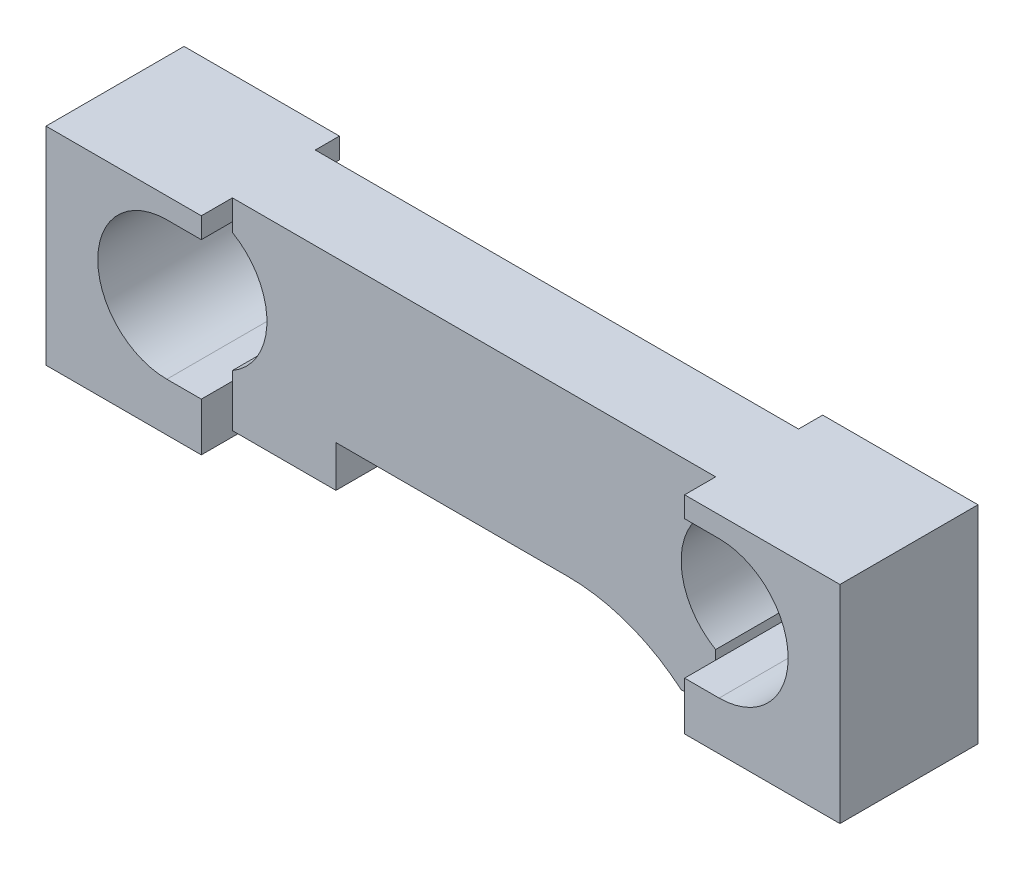
from build123d import *

# Parameters (mm, degrees)
SKETCH1_W           = 292.1
SKETCH1_H           = 50.8
BOSS_EXTRUDE1_DEPTH = 76.2
SKETCH2_W           = 177.8
SKETCH2_H           = 11.43
SKETCH2_H_2         = 8.89
CUT_EXTRUDE1_DEPTH  = 307.120058147
SKETCH3_W           = 177.8
SKETCH3_H           = 30.48
CUT_EXTRUDE2_DEPTH  = 2.032
SKETCH4_W           = 139.7
SKETCH4_H           = 30.48
CUT_EXTRUDE3_DEPTH  = 15.24
SKETCH5_W           = 12.7
SKETCH5_H           = 30.48
BOSS_EXTRUDE2_DEPTH = 15.24
FILLET1_R           = 64.77
CUT_EXTRUDE4_DEPTH  = 307.120058147
CUT_EXTRUDE5_DEPTH  = 307.120058147


with BuildPart() as part:
    # Sketch1 → Boss-Extrude1 (new body)
    with BuildSketch(Plane(origin=(0, 0, 0), x_dir=(1, 0, 0), z_dir=(0, 1, 0))):
        with Locations((146.05, 25.4)):
            Rectangle(SKETCH1_W, SKETCH1_H)
    extrude(amount=BOSS_EXTRUDE1_DEPTH)

    # Sketch2 → Cut-Extrude1 (cut, through all)
    with BuildSketch(Plane.XZ):
        with Locations((146.05, -5.715)):
            Rectangle(SKETCH2_W, SKETCH2_H)
        with Locations((146.05, -46.355)):
            Rectangle(SKETCH2_W, SKETCH2_H_2)
    extrude(amount=-CUT_EXTRUDE1_DEPTH, mode=Mode.SUBTRACT)

    # Sketch3 → Cut-Extrude2 (cut)
    with BuildSketch(Plane.XZ):
        with Locations((146.05, -26.67)):
            Rectangle(SKETCH3_W, SKETCH3_H)
    extrude(amount=-CUT_EXTRUDE2_DEPTH, mode=Mode.SUBTRACT)

    # Sketch4 → Cut-Extrude3 (cut)
    with BuildSketch(Plane.XZ.offset(-2.032)):
        with Locations((165.1, -26.67)):
            Rectangle(SKETCH4_W, SKETCH4_H)
    extrude(amount=-CUT_EXTRUDE3_DEPTH, mode=Mode.SUBTRACT)

    # Sketch5 → Boss-Extrude2 (add)
    with BuildSketch(Plane.XZ.offset(-17.272)):
        with Locations((228.6, -26.67)):
            Rectangle(SKETCH5_W, SKETCH5_H)
    extrude(amount=BOSS_EXTRUDE2_DEPTH)

    # Fillet1
    # the kernel refuses this fillet: 64.77 mm, written as the material it adds along each edge
    with BuildSketch(Plane(origin=(222.25, 17.272, -41.91), x_dir=(0, -1, 0), z_dir=(0, 0, 1))) as fillet1_piece_1:
        with BuildLine():
            CenterArc((64.77, -41.736458882), FILLET1_R, 139.880833102, 40.119166898)
            Line((0, -41.736458882), (-1.2954, -41.736458882))
            Line((-1.2954, -41.736458882), (-1.2954, 0))
            Line((-1.2954, 0), (0, 1.2954))
            ThreePointArc((0, 1.2954), (7.62, 1.2954), (14.2494, 0.834729178))
            Line((14.2494, 0.834729178), (15.24, 0))
        make_face()
    extrude(amount=30.48)

    # Sketch6 → Cut-Extrude4 (cut, through all)
    with BuildSketch(Plane.XY):
        with BuildLine():
            Line((44.45, 17.78), (57.15, 17.78))
            Line((57.15, 17.78), (57.15, 21.182954744))
            ThreePointArc((57.15, 21.182954744), (69.85, 43.18), (57.15, 65.177045256))
            Line((57.15, 65.177045256), (57.15, 68.58))
            Line((57.15, 68.58), (44.45, 68.58))
            ThreePointArc((44.45, 68.58), (19.05, 43.18), (44.45, 17.78))
        make_face()
    extrude(amount=-CUT_EXTRUDE4_DEPTH, mode=Mode.SUBTRACT)

    # Sketch7 → Cut-Extrude5 (cut, through all)
    with BuildSketch(Plane.XY):
        with BuildLine():
            Line((247.65, 17.78), (234.95, 17.78))
            Line((234.95, 17.78), (234.95, 21.182954744))
            ThreePointArc((234.95, 21.182954744), (222.25, 43.18), (234.95, 65.177045256))
            Line((234.95, 65.177045256), (234.95, 68.58))
            Line((234.95, 68.58), (247.65, 68.58))
            ThreePointArc((247.65, 68.58), (273.05, 43.18), (247.65, 17.78))
        make_face()
    extrude(amount=-CUT_EXTRUDE5_DEPTH, mode=Mode.SUBTRACT)


solid = part.part
